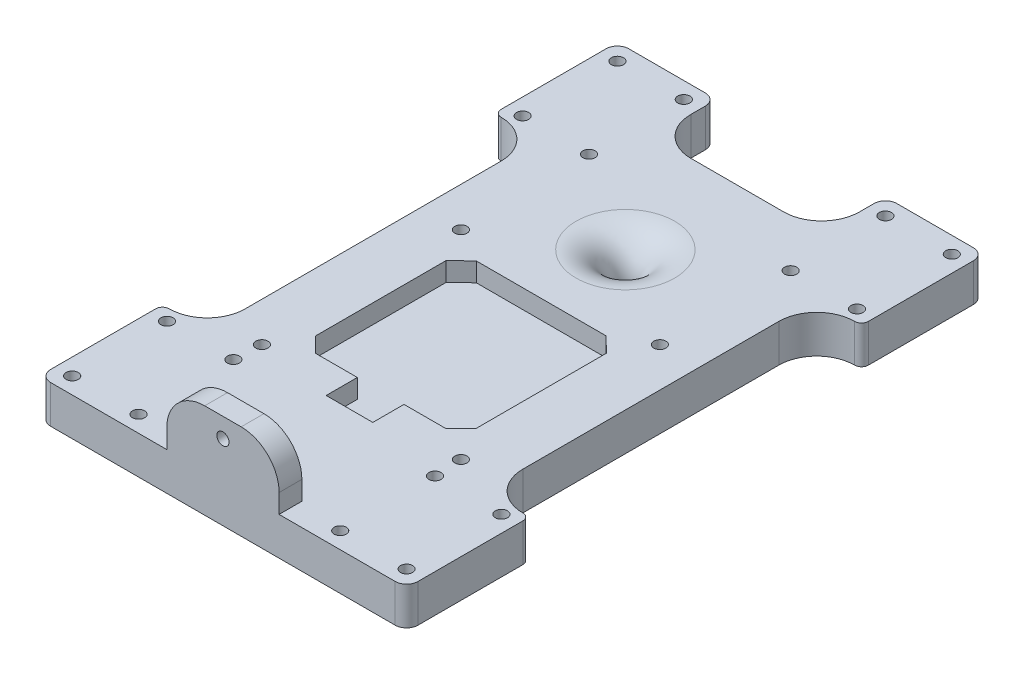
from build123d import *

# Parameters (mm, degrees)
SKETCH1_R           = 1.6
SKETCH1_R_2         = 3
BOSS_EXTRUDE1_DEPTH = 10
BOSS_EXTRUDE2_DEPTH = 5
SKETCH3_R           = 1.6
CUT_EXTRUDE2_DEPTH  = 24
FILLET1_R           = 10
SKETCH4_W           = 29.614558854
SKETCH4_H           = 6.006759352
BOSS_EXTRUDE3_DEPTH = 15
FILLET2_R           = 10
SKETCH5_R           = 1.6
CUT_EXTRUDE3_DEPTH  = 15


with BuildPart() as part:
    # Sketch1 → Boss-Extrude1 (new body)
    with BuildSketch(Plane(origin=(0, 0, 0), x_dir=(1, 0, 0), z_dir=(0, 1, 0))):
        with BuildLine():
            Line((13.581493994, 58.752113328), (-10.918506006, 58.752113328))
            ThreePointArc((-10.918506006, 58.752113328), (-17.989573818, 61.681045517), (-20.918506006, 68.752113328))
            Line((-20.918506006, 68.752113328), (-20.918506006, 72.587513875))
            ThreePointArc((-20.918506006, 72.587513875), (-21.797185662, 74.708834218), (-23.918506006, 75.587513875))
            Line((-23.918506006, 75.587513875), (-44.093226465, 75.587513875))
            ThreePointArc((-44.093226465, 75.587513875), (-46.214546809, 74.708834218), (-47.093226465, 72.587513875))
            Line((-47.093226465, 72.587513875), (-47.093226465, 44.912793415))
            ThreePointArc((-47.093226465, 44.912793415), (-46.566018672, 43.640001209), (-45.293226465, 43.112793415))
            Line((-45.293226465, 43.112793415), (-45.277758982, 43.112793415))
            ThreePointArc((-45.277758982, 43.112793415), (-38.20669117, 40.183861227), (-35.277758982, 33.112793415))
            Line((-35.277758982, 33.112793415), (-35.277758982, -34.387206585))
            ThreePointArc((-35.277758982, -34.387206585), (-38.20669117, -41.458274396), (-45.277758982, -44.387206585))
            Line((-45.277758982, -44.387206585), (-45.293226465, -44.387206585))
            ThreePointArc((-45.293226465, -44.387206585), (-46.566018672, -44.914414378), (-47.093226465, -46.187206585))
            Line((-47.093226465, -46.187206585), (-47.093226465, -73.861927044))
            ThreePointArc((-47.093226465, -73.861927044), (-46.214546809, -75.983247388), (-44.093226465, -76.861927044))
            Line((-44.093226465, -76.861927044), (46.756214453, -76.861927044))
            ThreePointArc((46.756214453, -76.861927044), (48.877534797, -75.983247388), (49.756214453, -73.861927044))
            Line((49.756214453, -73.861927044), (49.756214453, -46.187206585))
            ThreePointArc((49.756214453, -46.187206585), (49.22900666, -44.914414378), (47.956214453, -44.387206585))
            Line((47.956214453, -44.387206585), (47.94130771, -44.387206585))
            ThreePointArc((47.94130771, -44.387206585), (40.870239898, -41.458274396), (37.94130771, -34.387206585))
            Line((37.94130771, -34.387206585), (37.94130771, 33.112793415))
            ThreePointArc((37.94130771, 33.112793415), (40.870239898, 40.183861227), (47.94130771, 43.112793415))
            Line((47.94130771, 43.112793415), (47.956214453, 43.112793415))
            ThreePointArc((47.956214453, 43.112793415), (49.22900666, 43.640001209), (49.756214453, 44.912793415))
            Line((49.756214453, 44.912793415), (49.756214453, 72.587513875))
            ThreePointArc((49.756214453, 72.587513875), (48.877534797, 74.708834218), (46.756214453, 75.587513875))
            Line((46.756214453, 75.587513875), (26.581493994, 75.587513875))
            ThreePointArc((26.581493994, 75.587513875), (24.46017365, 74.708834218), (23.581493994, 72.587513875))
            Line((23.581493994, 72.587513875), (23.581493994, 68.752113328))
            ThreePointArc((23.581493994, 68.752113328), (20.652561806, 61.681045517), (13.581493994, 58.752113328))
        make_face()
        with Locations(Location((-42.755866236, -47.524566814, 0), (0, 0, 90))):
            Circle(SKETCH1_R, mode=Mode.SUBTRACT)
        with Locations(Location((-25.255866236, -47.524566814, 0), (0, 0, 90))):
            Circle(SKETCH1_R, mode=Mode.SUBTRACT)
        with Locations(Location((-25.255866236, -72.524566814, 0), (0, 0, 90))):
            Circle(SKETCH1_R, mode=Mode.SUBTRACT)
        with Locations(Location((-42.755866236, -72.524566814, 0), (0, 0, 90))):
            Circle(SKETCH1_R, mode=Mode.SUBTRACT)
        Polygon((-15.746148386, 7.031408071), (18.409136374, 7.031408071), (22.481493994, 3.156595611), (22.481493994, -31.29377947), (18.506681534, -35.268591929), (7.482919934, -35.268591929), (7.482919934, -43.496504735), (-4.819931946, -43.496504735), (-4.819931946, -35.268591929), (-15.843693546, -35.268591929), (-19.818506006, -31.29377947), (-19.818506006, 3.156595611), align=None, mode=Mode.SUBTRACT)
        with Locations(Location((45.418854224, -72.524566814, 0), (0, 0, 270))):
            Circle(SKETCH1_R, mode=Mode.SUBTRACT)
        with Locations(Location((27.918854224, -72.524566814, 0), (0, 0, 270))):
            Circle(SKETCH1_R, mode=Mode.SUBTRACT)
        with Locations(Location((27.918854224, -47.524566814, 0), (0, 0, 270))):
            Circle(SKETCH1_R, mode=Mode.SUBTRACT)
        with Locations(Location((45.418854224, -47.524566814, 0), (0, 0, 270))):
            Circle(SKETCH1_R, mode=Mode.SUBTRACT)
        with Locations(Location((1.331493994, 29.261782359, 0), (0, 0, 270))):
            Circle(SKETCH1_R_2, mode=Mode.SUBTRACT)
        with Locations(Location((-42.755866236, 71.250153645, 0), (0, 0, 270))):
            Circle(SKETCH1_R, mode=Mode.SUBTRACT)
        with Locations(Location((-42.755866236, 46.250153645, 0), (0, 0, 270))):
            Circle(SKETCH1_R, mode=Mode.SUBTRACT)
        with Locations(Location((-25.255866236, 46.250153645, 0), (0, 0, 270))):
            Circle(SKETCH1_R, mode=Mode.SUBTRACT)
        with Locations(Location((-25.255866236, 71.250153645, 0), (0, 0, 270))):
            Circle(SKETCH1_R, mode=Mode.SUBTRACT)
        with Locations(Location((27.918854224, 46.250153645, 0), (0, 0, 90))):
            Circle(SKETCH1_R, mode=Mode.SUBTRACT)
        with Locations(Location((27.918854224, 71.250153645, 0), (0, 0, 90))):
            Circle(SKETCH1_R, mode=Mode.SUBTRACT)
        with Locations(Location((45.418854224, 71.250153645, 0), (0, 0, 90))):
            Circle(SKETCH1_R, mode=Mode.SUBTRACT)
        with Locations(Location((45.418854224, 46.250153645, 0), (0, 0, 90))):
            Circle(SKETCH1_R, mode=Mode.SUBTRACT)
    extrude(amount=BOSS_EXTRUDE1_DEPTH)

    # Sketch1<3> → Boss-Extrude2 (add)
    with BuildSketch(Plane(origin=(0, 0, 0), x_dir=(1, 0, 0), z_dir=(0, 1, 0))):
        Polygon((18.409136374, 7.031408071), (-15.746148386, 7.031408071), (-19.818506006, 3.156595611), (-19.818506006, -31.29377947), (-15.843693546, -35.268591929), (-4.819931946, -35.268591929), (-4.819931946, -43.496504735), (7.482919934, -43.496504735), (7.482919934, -35.268591929), (18.506681534, -35.268591929), (22.481493994, -31.29377947), (22.481493994, 3.156595611), align=None)
    extrude(amount=BOSS_EXTRUDE2_DEPTH)

    # Sketch3 → Cut-Extrude2 (cut)
    with BuildSketch(Plane(origin=(0, 10, 0), x_dir=(1, 0, 0), z_dir=(0, 1, 0))):
        with Locations(Location((-24.902167588, -40.352253511, 0), (0, 0, 270))):
            Circle(SKETCH3_R)
        with Locations(Location((27.565155576, -40.352253511, 0), (0, 0, 90))):
            Circle(SKETCH3_R)
        with Locations(Location((27.565155576, 12.115069653, 0), (0, 0, 270))):
            Circle(SKETCH3_R)
        with Locations(Location((-24.902167588, 12.115069653, 0), (0, 0, 90))):
            Circle(SKETCH3_R)
    extrude(amount=-CUT_EXTRUDE2_DEPTH, mode=Mode.SUBTRACT)

    # Fillet1
    fillet1_edges = [part.edges().sort_by_distance(p)[0] for p in [
        (1.331493994, 10, -32.261782359),
    ]]
    fillet(fillet1_edges, radius=FILLET1_R - 0.0001)  # a hair under: the kernel refuses the full size

    # Sketch4 → Boss-Extrude3 (add)
    with BuildSketch(Plane(origin=(0, 10, 0), x_dir=(1, 0, 0), z_dir=(0, 1, 0))):
        with Locations((1.331493994, -73.858547368)):
            Rectangle(SKETCH4_W, SKETCH4_H)
    extrude(amount=BOSS_EXTRUDE3_DEPTH)

    # Fillet2
    fillet2_edges = [part.edges().sort_by_distance(p)[0] for p in [
        (16.138773421, 25, 73.858547368),
        (-13.475785433, 25, 73.858547368),
    ]]
    fillet(fillet2_edges, radius=FILLET2_R)

    # Sketch5 → Cut-Extrude3 (cut)
    with BuildSketch(Plane.XY.offset(76.861927044)):
        with Locations((1.331493994, 19.855091715)):
            Circle(SKETCH5_R)
    extrude(amount=-CUT_EXTRUDE3_DEPTH, mode=Mode.SUBTRACT)


solid = part.part
